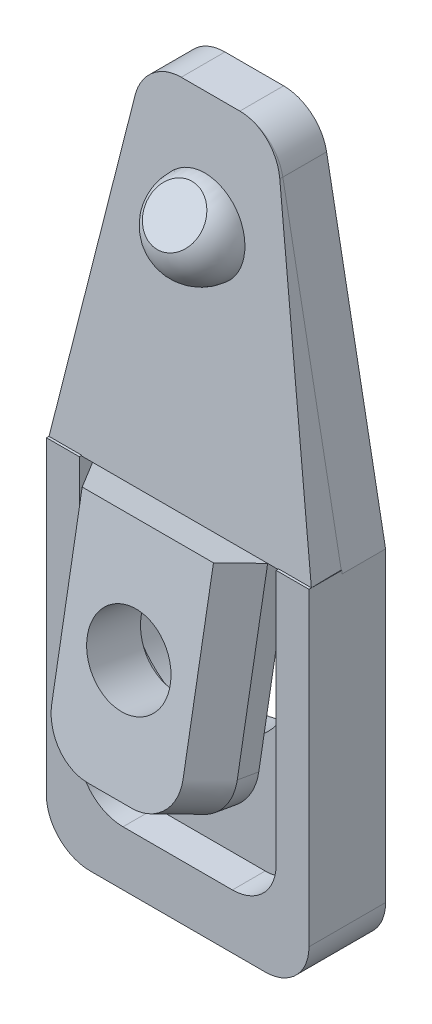
from build123d import *
from build123d.topology import SkipClean

# Parameters (mm, degrees)
BOSS_EXTRUDE1_DEPTH     = 2
FINGERGRIP_DEPTH        = 0.3
BOSS_EXTRUDE2_DEPTH     = 2
REVOLVE1_ANGLE          = 180
CUT_EXTRUDE3_DEPTH      = 24.23093064
CUT_EXTRUDE3_DEPTH_BACK = 24.23093064
BOSS_EXTRUDE6_DEPTH     = 1
SKETCH24_R              = 1.9
SCREW_THREADS_DEPTH     = 2.5
SCREW_HEAD_REACH        = 24.485
SKETCH25_R              = 3.75
BOSS_EXTRUDE9_DEPTH     = 1.5


with BuildPart() as part:
    # Sketch1 → Boss-Extrude1 (new body)
    with BuildSketch(Plane.XY):
        with BuildLine():
            Line((-4, -10), (4, -10))
            ThreePointArc((4, -10), (5.414213562, -9.414213562), (6, -8))
            Line((6, -8), (6, 6))
            Line((6, 6), (3.305891799, 20.36857707))
            ThreePointArc((3.305891799, 20.36857707), (2.6174191, 21.539018216), (1.340147425, 22))
            Line((1.340147425, 22), (-1.340147425, 22))
            ThreePointArc((-1.340147425, 22), (-2.6174191, 21.539018216), (-3.305891799, 20.36857707))
            Line((-3.305891799, 20.36857707), (-6, 6))
            Line((-6, 6), (-6, -8))
            ThreePointArc((-6, -8), (-5.414213562, -9.414213562), (-4, -10))
        make_face()
    extrude(amount=BOSS_EXTRUDE1_DEPTH)

    # Sketch8 → FingerGrip (cut)
    with BuildSketch(Plane(origin=(0, 0, 0), x_dir=(-1, 0, 0), z_dir=(0, 0, -1))):
        with BuildLine():
            Line((-4, -4), (4, -4))
            ThreePointArc((4, -4), (4.75, -4.75), (4, -5.5))
            Line((4, -5.5), (-4, -5.5))
            ThreePointArc((-4, -5.5), (-4.75, -4.75), (-4, -4))
        make_face()
        with BuildLine():
            Line((-4, -7), (4, -7))
            ThreePointArc((4, -7), (4.75, -7.75), (4, -8.5))
            Line((4, -8.5), (-4, -8.5))
            ThreePointArc((-4, -8.5), (-4.75, -7.75), (-4, -7))
        make_face()
    extrude(amount=-FINGERGRIP_DEPTH, mode=Mode.SUBTRACT)

    # Sketch2 → Boss-Extrude2 (add)
    with BuildSketch(Plane(origin=(0, 0.340762895, 3.894937707), x_dir=(-1, 0, 0), z_dir=(0, 0.08715574274765835, 0.9961946980917455))):
        with BuildLine():
            Line((6, -5.802856703), (-6, -5.802856703))
            Line((-6, -5.802856703), (-3.305891799, -20.116756999))
            add(Edge.make_bspline(
                [(-3.305891799, -20.116756999), (-3, -21.741971873), (-1.340147425, -21.741971873)],
                knots=[3.326940604, 3.326940604, 3.326940604, 4.71238898, 4.71238898, 4.71238898], degree=2, weights=[1, 0.769509108, 1]))
            Line((-1.340147425, -21.741971873), (1.340147425, -21.741971873))
            add(Edge.make_bspline(
                [(1.340147425, -21.741971873), (3, -21.741971873), (3.305891799, -20.116756999)],
                knots=[4.71238898, 4.71238898, 4.71238898, 6.097837357, 6.097837357, 6.097837357], degree=2, weights=[1, 0.769509108, 1]))
            Line((3.305891799, -20.116756999), (6, -5.802856703))
        make_face()
    extrude(amount=-BOSS_EXTRUDE2_DEPTH)

    # Sketch9 → Revolve1 (revolve)
    with BuildSketch(Plane(origin=(0, 0.340762895, 3.894937707), x_dir=(1, 0, 0), z_dir=(0, 0.08715574274765836, 0.9961946980917457))):
        with BuildLine():
            Line((-2, 16.741971873), (2, 16.741971873))
            ThreePointArc((2, 16.741971873), (0, 14.741971873), (-2, 16.741971873))
        make_face()
    revolve(axis=Axis((0, 17.01902651, 2.435778714), (-1, 0, 0)), revolution_arc=REVOLVE1_ANGLE)

    # Sketch11 → Cut-Extrude3 (cut, two sides: drawn at the far end of the back side and taken through both)
    with SkipClean():  # the faces are left unmerged after this step: merging them gives an invalid solid
        with BuildSketch(Plane(origin=(0, 0, 0), x_dir=(0, 0, -1), z_dir=(1, 0, 0)).offset(-CUT_EXTRUDE3_DEPTH_BACK)):
            Polygon((-4.435231088, 17.065826116), (-2.847274196, 18.976236633), (-5.75514434, 18.976236633), align=None)
        extrude(amount=CUT_EXTRUDE3_DEPTH + CUT_EXTRUDE3_DEPTH_BACK, mode=Mode.SUBTRACT)

    # Sketch17 → Boss-Extrude6 (add)
    with SkipClean():  # the faces are left unmerged after this step: merging them gives an invalid solid
        with BuildSketch(Plane(origin=(0, 0.764171798, 4.333833624), x_dir=(1, 0, 0), z_dir=(0, 0.1736481776669307, 0.984807753012208))):
            with BuildLine():
                Line((-4, 7.440012187), (-4, -2.559987813))
                ThreePointArc((-4, -2.559987813), (-3.414213562, -3.974201376), (-2, -4.559987813))
                Line((-2, -4.559987813), (2, -4.559987813))
                ThreePointArc((2, -4.559987813), (3.414213562, -3.974201376), (4, -2.559987813))
                Line((4, -2.559987813), (4, 7.440012187))
                Line((4, 7.440012187), (-4, 7.440012187))
            make_face()
        extrude(amount=-BOSS_EXTRUDE6_DEPTH)

    # ChannelLoft: read off the stored shape, not the designer's step
    # ChannelLoft: loft between two sections, ruled curve by curve
    with SkipClean():  # the faces are left unmerged after this step: merging them gives an invalid solid
        channelloft_from = [
            Edge.make_bspline([(-4, -1.756924048, 4.778370843), (-4, -2.014746113, 4.823831829), (-3.898054886, -2.510779884, 4.911295966), (-3.490581388, -3.139356468, 5.022130977), (-2.860154576, -3.59177544, 5.101904649), (-2.307528784, -3.726539554, 5.125667198), (-1.712396065, -3.726539554, 5.125667198), (-1.084847785, -3.726539554, 5.125667198), (0, -3.726539554, 5.125667198), (1.084847785, -3.726539554, 5.125667198), (1.712396065, -3.726539554, 5.125667198), (2.307528784, -3.726539554, 5.125667198), (2.860154576, -3.59177544, 5.101904649), (3.490581388, -3.139356468, 5.022130977), (3.898054886, -2.510779884, 4.911295966), (4, -2.014746113, 4.823831829), (4, -1.100385546, 4.662605391), (4, 0.212691458, 4.431074487), (4, 2.182306964, 4.083778132), (4, 4.15192247, 3.736481777), (4, 5.464999474, 3.504950873), (4, 6.121537976, 3.389185421)], [0, 0, 0, 0, 0.045606382, 0.091212765, 0.136819147, 0.18242553, 0.18242553, 0.225077066, 0.267728602, 0.310380137, 0.353031673, 0.353031673, 0.398638056, 0.444244438, 0.489850821, 0.535457203, 0.535457203, 0.651592902, 0.767728602, 0.883864301, 1, 1, 1, 1], 3),
            Edge.make_line((-4, 6.121537976, 3.389185421), (4, 6.121537976, 3.389185421)),
            Edge.make_line((-4, 6.121537976, 3.389185421), (-4, -1.756924048, 4.778370843)),
        ]
        channelloft_to = [
            Edge.make_bspline([(-3, -1.496451782, 6.255582472), (-3, -1.754273847, 6.301043458), (-2.893884014, -2.296064841, 6.396575829), (-2.393282198, -2.988696668, 6.518705507), (-1.695041902, -3.393304949, 6.590048864), (-1.221405478, -3.466067288, 6.602878828), (-0.792939425, -3.466067288, 6.602878828), (-0.45676532, -3.466067288, 6.602878828), (0, -3.466067288, 6.602878828), (0.45676532, -3.466067288, 6.602878828), (0.792939425, -3.466067288, 6.602878828), (1.221405478, -3.466067288, 6.602878828), (1.695041902, -3.393304949, 6.590048864), (2.393282198, -2.988696668, 6.518705507), (2.893884014, -2.296064841, 6.396575829), (3, -1.754273847, 6.301043458), (3, -0.83991328, 6.13981702), (3, 0.473163724, 5.908286117), (3, 2.44277923, 5.560989762), (3, 4.412394736, 5.213693406), (3, 5.72547174, 4.982162503), (3, 6.382010242, 4.866397051)], [0, 0, 0, 0, 0.045606382, 0.091212765, 0.136819147, 0.18242553, 0.18242553, 0.225077066, 0.267728602, 0.310380137, 0.353031673, 0.353031673, 0.398638056, 0.444244438, 0.489850821, 0.535457203, 0.535457203, 0.651592902, 0.767728602, 0.883864301, 1, 1, 1, 1], 3),
            Edge.make_line((-3, 6.382010242, 4.866397051), (3, 6.382010242, 4.866397051)),
            Edge.make_line((-3, 6.382010242, 4.866397051), (-3, -1.496451782, 6.255582472)),
        ]
        channelloft = Solid(Shell([*[Face.make_surface_from_curves(channelloft_from[k], channelloft_to[k]) for k in range(3)], Face(Wire(channelloft_from)), Face(Wire(channelloft_to))]))
        add(channelloft)

    # Sketch24 → Screw Threads (cut)
    with SkipClean():  # the faces are left unmerged after this step: merging them gives an invalid solid
        with BuildSketch(Plane(origin=(0, 1.024644064, 5.811045254), x_dir=(1, 0, 0), z_dir=(0, 0.17364817766693072, 0.9848077530122081))):
            with Locations(Location((0, 0.440012187, 0), (0, 0, 270))):
                Circle(SKETCH24_R)
        extrude(amount=-SCREW_THREADS_DEPTH, mode=Mode.SUBTRACT)

    # Screw Head: up to this plane
    with SkipClean():  # the faces are left unmerged after this step: merging them gives an invalid solid
        screw_head_end = Plane(origin=(1.340147425, 20, 0), z_dir=(0, 0, 1))
        # Sketch25 → Screw Head (cut, up to the surface)
        with BuildSketch(Plane(origin=(0, 0.59052362, 3.349025871), x_dir=(-1, 0, 0), z_dir=(0, -0.1736481776669307, -0.9848077530122081)), mode=Mode.PRIVATE) as screw_head_sk1:
            with Locations(Location((0, 0.440012187, 0), (0, 0, 90))):
                Circle(SKETCH25_R)
        screw_head_tool1 = split(extrude(screw_head_sk1.sketch, amount=SCREW_HEAD_REACH, mode=Mode.PRIVATE), bisect_by=screw_head_end, keep=Keep.BOTH, mode=Mode.PRIVATE)
        add(screw_head_tool1.solids().sort_by_distance((0, 1.023851, 3.272619))[0], mode=Mode.SUBTRACT)

    # Sketch28 → Boss-Extrude9 (add)
    with SkipClean():  # the faces are left unmerged after this step: merging them gives an invalid solid
        with BuildSketch(Plane.XY.offset(2)):
            with BuildLine():
                Line((-6, 6.15), (-6, -8))
                ThreePointArc((-6, -8), (-5.414213562, -9.414213562), (-4, -10))
                Line((-4, -10), (4, -10))
                ThreePointArc((4, -10), (5.414213562, -9.414213562), (6, -8))
                Line((6, -8), (6, 6.15))
                Line((6, 6.15), (4.5, 6.15))
                Line((4.5, 6.15), (4.5, -5.5))
                ThreePointArc((4.5, -5.5), (3.914213562, -6.914213562), (2.5, -7.5))
                Line((2.5, -7.5), (-2.5, -7.5))
                ThreePointArc((-2.5, -7.5), (-3.914213562, -6.914213562), (-4.5, -5.5))
                Line((-4.5, -5.5), (-4.5, 6.15))
                Line((-4.5, 6.15), (-6, 6.15))
            make_face()
        extrude(amount=BOSS_EXTRUDE9_DEPTH)


solid = part.part
